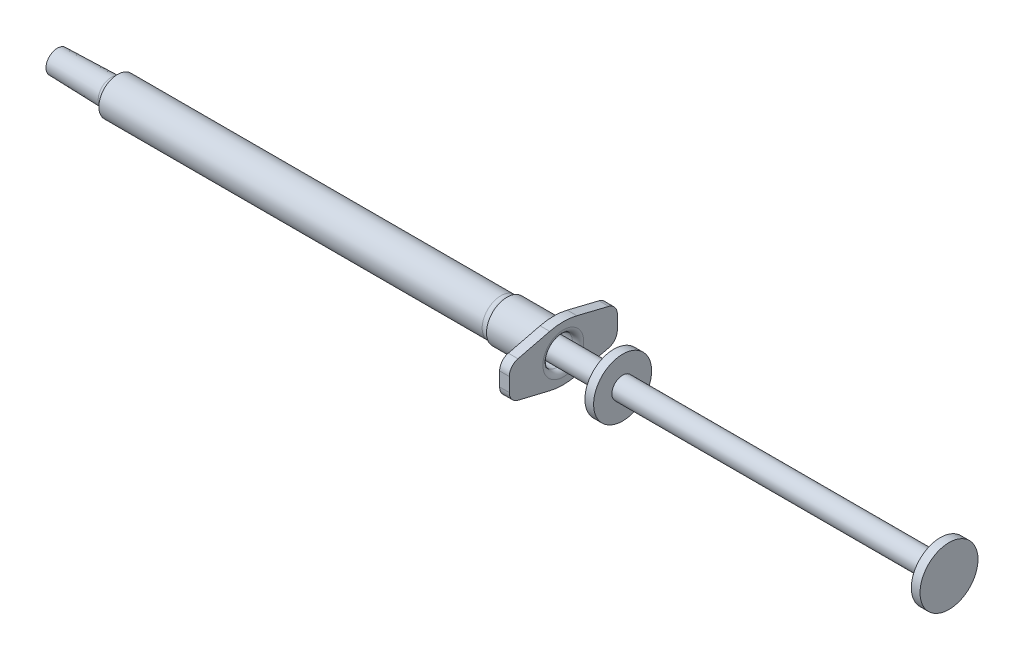
from build123d import *

# Parameters (mm, degrees)
BOSS_EXTRUDE1_START = 1.7
SKETCH3_R           = 2.593243827
BOSS_EXTRUDE1_DEPTH = 1.7
FILLET1_R           = 10
FILLET2_R           = 2
FILLET3_R           = 1


with BuildPart() as part:
    # Sketch1 → Revolve2 (revolve)
    with BuildSketch(Plane.XY, mode=Mode.PRIVATE) as revolve2_sk:
        Polygon((0, 3.41109089), (10, 3.41109089), (10.592218891, 3.791734015), (10.943346142, 5.124334717), (87.2781258, 5.124334717), (87.2781258, 6.14609089), (79.0781258, 6.14609089), (78.592218891, 5.83109089), (10.592218891, 5.83109089), (10, 4.80109089), (0, 4.53109089), align=None)
    revolve(revolve2_sk.sketch.rotate(Axis((0, 2.53109089, 0), (1, 0, 0)), 90), axis=Axis((0, 2.53109089, 0), (1, 0, 0)))

    # Sketch3 → Boss-Extrude1 (add)
    with BuildSketch(Plane(origin=(87.2781258, 0, 0), x_dir=(0, 0, -1), z_dir=(1, 0, 0)).offset(BOSS_EXTRUDE1_START)):
        Polygon((-9.499358108, 5.326551853), (0, 7.660573112), (9.499358108, 5.326551853), (9.499358108, -0.264370073), (-0.044115668, -2.539426888), (-9.499358108, -0.264370073), align=None)
        with Locations(Location((0, 2.53109089, 0), (0, 0, 180))):
            Circle(SKETCH3_R, mode=Mode.SUBTRACT)
    extrude(amount=-BOSS_EXTRUDE1_DEPTH)

    # Fillet1
    fillet1_edges = [part.edges().sort_by_distance(p)[0] for p in [
        (88.1281258, 7.660573112, 0),
        (88.1281258, -2.539426888, 0.044115668),
    ]]
    fillet(fillet1_edges, radius=FILLET1_R)

    # Fillet2
    # the kernel refuses this fillet: 2 mm, written as the material it adds along each edge
    with BuildSketch(Plane(origin=(78.592218891, 2.53109089, 0), x_dir=(0, 0, 1), z_dir=(0, 1, 0))) as fillet2_piece_1_section:
        with BuildLine():
            CenterArc((3.3 + FILLET2_R, -FILLET2_R * 0.295779032627), FILLET2_R, 147.045775179, 32.954224821)
            Line((3.3, -FILLET2_R * 0.295779032627), (3.3, 0))
            Line((3.3, 0), (3.3 + FILLET2_R * 0.160894572606, FILLET2_R * 0.248189791587))
        make_face()
    fillet2_piece_1 = revolve(axis=Axis((78.592218891, 2.53109089, 0), (1, 0, 0)), mode=Mode.PRIVATE)
    fillet2_piece_1 = fillet2_piece_1 & Plane(origin=(78.565259798, 2.53109089, 0), x_dir=(0, 0, 1), z_dir=(-1, 0, 0)) * Cylinder(3.615, 15, mode=Mode.PRIVATE)
    add(fillet2_piece_1)
    # the kernel refuses this fillet: 2 mm, written as the material it takes off along each edge
    with BuildSketch(Plane(origin=(92.926291949, -0.264370073, -9.499358108), x_dir=(0, 1, 0), z_dir=(-1, 0, 0))) as fillet2_2_piece_1:
        with BuildLine():
            CenterArc((FILLET2_R * 0.789633229804, -FILLET2_R), FILLET2_R, 90, 76.591588328)
            Line((-FILLET2_R * 0.183108614693, -FILLET2_R * 0.768109284435), (0, 0))
            Line((0, 0), (FILLET2_R * 0.789633229804, 0))
        make_face()
    extrude(amount=9.596332298, mode=Mode.SUBTRACT)
    with BuildSketch(Plane(origin=(92.898323954, 5.326551853, -9.499358108), x_dir=(0, 0.23860626001544996, 0.9711163950224707), z_dir=(-1, 0, 0))) as fillet2_2_piece_2:
        with BuildLine():
            CenterArc((FILLET2_R * 0.784039630972, -FILLET2_R), FILLET2_R, 90, 76.195704702)
            Line((-FILLET2_R * 0.18707676405, -FILLET2_R * 0.761393739985), (0, 0))
            Line((0, 0), (FILLET2_R * 0.784039630972, 0))
        make_face()
    extrude(amount=9.54039631, mode=Mode.SUBTRACT)
    with BuildSketch(Plane(origin=(92.898323954, 5.326551853, 9.499358108), x_dir=(0, 0.23860626001544943, -0.9711163950224709), z_dir=(-1, 0, 0))) as fillet2_2_piece_3:
        with BuildLine():
            CenterArc((FILLET2_R * 0.784039630972, FILLET2_R), FILLET2_R, 193.804295298, 76.195704702)
            Line((-FILLET2_R * 0.18707676405, FILLET2_R * 0.761393739985), (0, 0))
            Line((0, 0), (FILLET2_R * 0.784039630972, 0))
        make_face()
    extrude(amount=9.54039631, mode=Mode.SUBTRACT)
    with BuildSketch(Plane(origin=(92.917759965, -0.264370073, 9.499358108), x_dir=(0, 1, 0), z_dir=(-1, 0, 0))) as fillet2_2_piece_4:
        with BuildLine():
            CenterArc((FILLET2_R * 0.787926833026, FILLET2_R), FILLET2_R, 193.528952804, 76.471047196)
            Line((-FILLET2_R * 0.184324998206, FILLET2_R * 0.766063306286), (0, 0))
            Line((0, 0), (FILLET2_R * 0.787926833026, 0))
        make_face()
    extrude(amount=9.57926833, mode=Mode.SUBTRACT)

    # Fillet3
    fillet3_edges = [part.edges().sort_by_distance(p)[0] for p in [
        (10, 2.53109089, -2.27),
        (87.2781258, 2.53109089, -3.615),
        (88.9781258, 2.53109089, -2.593243827),
    ]]
    fillet(fillet3_edges, radius=FILLET3_R)


with BuildPart() as body_2:
    # Sketch2 → Revolve3 (revolve)
    with BuildSketch(Plane.XY, mode=Mode.PRIVATE) as revolve3_sk:
        Polygon((10.515649659, 2.53109089), (11.168160759, 5.075645566), (16.344070093, 5.075645566), (16.50558566, 4.42109089), (97.8781258, 4.42109089), (97.8781258, 7.63109089), (99.4081258, 7.63109089), (99.4081258, 4.42109089), (155.2781258, 4.42109089), (155.2781258, 7.63109089), (156.8081258, 7.63109089), (156.8081258, 2.53109089), align=None)
    revolve(revolve3_sk.sketch.rotate(Axis((105.886554745, 2.53109089, 0), (-1, 0, 0)), 90), axis=Axis((105.886554745, 2.53109089, 0), (-1, 0, 0)))


solid = Compound([part.part, body_2.part])
